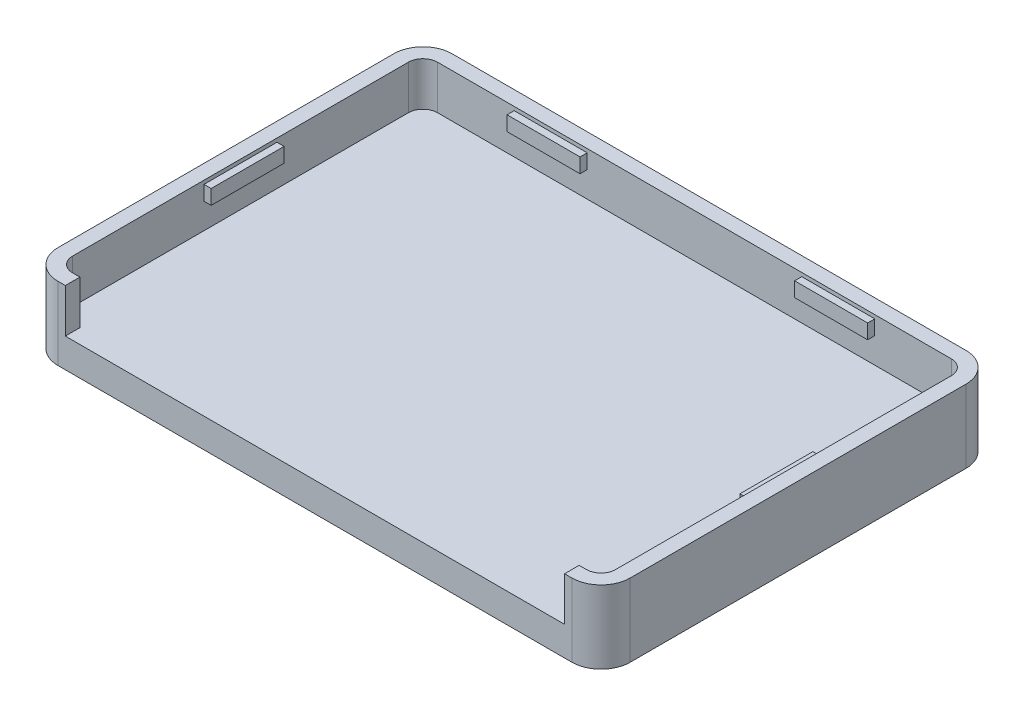
from build123d import *

# Parameters (mm, degrees)
BOSS_EXTRU_1_DEPTH      = 5
ENL_V_MAT_EXTRU_1_DEPTH = 3
ESQUISSE3_W             = 34.2
ESQUISSE3_H             = 3
ENL_V_MAT_EXTRU_2_DEPTH = 3
ESQUISSE4_W             = 5
ESQUISSE4_H             = 1
BOSS_EXTRU_2_DEPTH      = 0.48904
ESQUISSE5_W             = 5
ESQUISSE5_H             = 1
BOSS_EXTRU_3_DEPTH      = 0.48904
ESQUISSE6_W             = 5
ESQUISSE6_H             = 1
BOSS_EXTRU_4_DEPTH      = 0.48904


with BuildPart() as part:
    # Esquisse1 → Boss.-Extru.1 (new body)
    with BuildSketch(Plane(origin=(0, 0, 0), x_dir=(1, 0, 0), z_dir=(0, 1, 0))):
        with BuildLine():
            Line((2, 0), (37.2, 0))
            ThreePointArc((37.2, 0), (38.614213562, 0.585786438), (39.2, 2))
            Line((39.2, 2), (39.2, 25))
            ThreePointArc((39.2, 25), (38.614213562, 26.414213562), (37.2, 27))
            Line((37.2, 27), (2, 27))
            ThreePointArc((2, 27), (0.585786438, 26.414213562), (0, 25))
            Line((0, 25), (0, 2))
            ThreePointArc((0, 2), (0.585786438, 0.585786438), (2, 0))
        make_face()
    extrude(amount=BOSS_EXTRU_1_DEPTH)

    # Esquisse2 → Enlèv. mat.-Extru.1 (cut)
    with BuildSketch(Plane(origin=(0, 5, 0), x_dir=(1, 0, 0), z_dir=(0, 1, 0))):
        with BuildLine():
            Line((38.2, 2), (38.2, 25))
            ThreePointArc((38.2, 25), (37.907106781, 25.707106781), (37.2, 26))
            Line((37.2, 26), (2, 26))
            ThreePointArc((2, 26), (1.292893219, 25.707106781), (1, 25))
            Line((1, 25), (1, 2))
            ThreePointArc((1, 2), (1.292893219, 1.292893219), (2, 1))
            Line((2, 1), (37.2, 1))
            ThreePointArc((37.2, 1), (37.907106781, 1.292893219), (38.2, 2))
        make_face()
    extrude(amount=-ENL_V_MAT_EXTRU_1_DEPTH, mode=Mode.SUBTRACT)

    # Esquisse3 → Enlèv. mat.-Extru.2 (cut)
    with BuildSketch(Plane.XY):
        with Locations((19.6, 3.5)):
            Rectangle(ESQUISSE3_W, ESQUISSE3_H)
    extrude(amount=-ENL_V_MAT_EXTRU_2_DEPTH, mode=Mode.SUBTRACT)

    # Esquisse4 → Boss.-Extru.2 (add)
    with BuildSketch(Plane(origin=(1, 0, 0), x_dir=(0, 0, -1), z_dir=(1, 0, 0))):
        with Locations((13.5, 4.25)):
            Rectangle(ESQUISSE4_W, ESQUISSE4_H)
    extrude(amount=BOSS_EXTRU_2_DEPTH)

    # Esquisse5 → Boss.-Extru.3 (add)
    with BuildSketch(Plane.ZY.offset(-38.2)):
        with Locations((-13.5, 4.25)):
            Rectangle(ESQUISSE5_W, ESQUISSE5_H)
    extrude(amount=BOSS_EXTRU_3_DEPTH)

    # Esquisse6 → Boss.-Extru.4 (add)
    with BuildSketch(Plane.XY.offset(-26)):
        with Locations((9.75, 4.25)):
            Rectangle(ESQUISSE6_W, ESQUISSE6_H)
        with Locations((29.45, 4.25)):
            Rectangle(ESQUISSE6_W, ESQUISSE6_H)
    extrude(amount=BOSS_EXTRU_4_DEPTH)


solid = part.part
